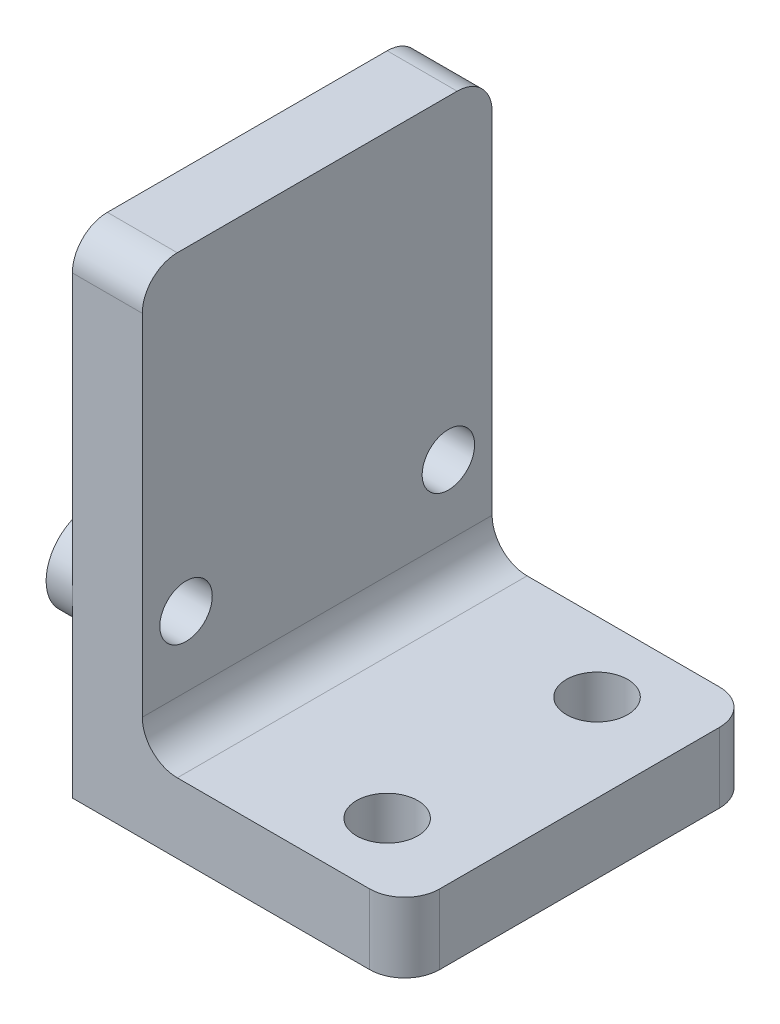
from build123d import *

# Parameters (mm, degrees)
BOSS_EXTRUDE1_DEPTH = 20
SKETCH2_R           = 1.5
CUT_EXTRUDE1_DEPTH  = 40.306488014
SKETCH3_R           = 1.75
CUT_EXTRUDE2_DEPTH  = 37.565010598
FILLET1_R           = 2
BOSS_EXTRUDE2_START = 1.5
SKETCH4_R           = 2.5
SKETCH4_R_2         = 1.5
BOSS_EXTRUDE2_DEPTH = 1.5


with BuildPart() as part:
    # Sketch1 → Boss-Extrude1 (new body)
    with BuildSketch(Plane.XY):
        Polygon((0, 0), (0, 28), (4, 28), (4, 4), (19, 4), (19, 0), align=None)
    extrude(amount=BOSS_EXTRUDE1_DEPTH)

    # Sketch2 → Cut-Extrude1 (cut, through all)
    with BuildSketch(Plane.ZY):
        with Locations((17.5, 10)):
            Circle(SKETCH2_R)
        with Locations((2.5, 10)):
            Circle(SKETCH2_R)
    extrude(amount=-CUT_EXTRUDE1_DEPTH, mode=Mode.SUBTRACT)

    # Sketch3 → Cut-Extrude2 (cut, through all)
    with BuildSketch(Plane(origin=(0, 4, 0), x_dir=(1, 0, 0), z_dir=(0, 1, 0))):
        with Locations((14, -4)):
            Circle(SKETCH3_R)
        with Locations((14, -16)):
            Circle(SKETCH3_R)
    extrude(amount=-CUT_EXTRUDE2_DEPTH, mode=Mode.SUBTRACT)

    # Fillet1
    fillet1_edges = [part.edges().sort_by_distance(p)[0] for p in [
        (19, 2, 0),
        (19, 2, 20),
        (4, 4, 10),
        (2, 28, 0),
        (2, 28, 20),
    ]]
    fillet(fillet1_edges, radius=FILLET1_R)

    # Sketch4 → Boss-Extrude2 (add)
    # profile 1 of 2: a face of its own
    with BuildSketch(Plane.ZY.offset(BOSS_EXTRUDE2_START)):
        with Locations((2.5, 10)):
            Circle(SKETCH4_R)
        with Locations((2.5, 10)):
            Circle(SKETCH4_R_2, mode=Mode.SUBTRACT)
    # profile 2 of 2: a face of its own
    with BuildSketch(Plane.ZY.offset(BOSS_EXTRUDE2_START)):
        with Locations((17.5, 10)):
            Circle(SKETCH4_R)
        with Locations((17.5, 10)):
            Circle(SKETCH4_R_2, mode=Mode.SUBTRACT)
    extrude(amount=-BOSS_EXTRUDE2_DEPTH)


solid = part.part
